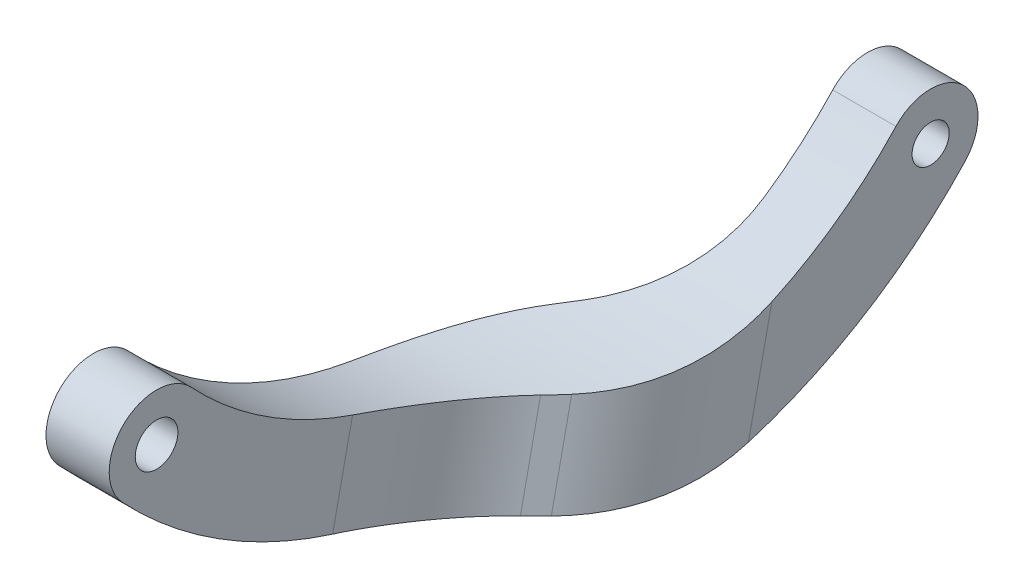
from build123d import *

# Parameters (mm, degrees)
SKETCH_1_R          = 1.175
SKETCH_1_R_2        = 1.35
EXTRUDE_1_DEPTH     = 4
SKETCH_1_5_R        = 1.175
EXTRUDE_2_DEPTH     = 12
SKETCH_1_6_R        = 1.175
CUT_EXTRUDE_1_DEPTH = 8
SKETCH_3_R          = 1.625
CUT_EXTRUDE_2_DEPTH = 1
CHAMFER_1_SIZE      = 10
FILLET_1_R          = 12


with BuildPart() as part:
    # 草图1 → 凸台-拉伸1 (new body)
    with BuildSketch(Plane(origin=(0, 0, 0), x_dir=(0, 0, -1), z_dir=(1, 0, 0))):
        with BuildLine():
            ThreePointArc((-22.696428571, -2.043453335), (0, -11.927768877), (22.696428571, -2.043453335))
            ThreePointArc((22.696428571, -2.043453335), (22.543453335, 2.196428571), (18.303571429, 2.043453335))
            ThreePointArc((18.303571429, 2.043453335), (0, -5.927768877), (-18.303571429, 2.043453335))
            ThreePointArc((-18.303571429, 2.043453335), (-22.543453335, 2.196428571), (-22.696428571, -2.043453335))
        make_face()
        with Locations((20.5, 0)):
            Circle(SKETCH_1_R, mode=Mode.SUBTRACT)
        with Locations((-20.5, 0)):
            Circle(SKETCH_1_R_2, mode=Mode.SUBTRACT)
    extrude(amount=EXTRUDE_1_DEPTH)

    # 草图1<5> → 凸台-拉伸2 (add)
    # profile 1 of 2: a face of its own
    with BuildSketch(Plane(origin=(0, 0, 0), x_dir=(0, 0, -1), z_dir=(1, 0, 0))):
        with BuildLine():
            Line((-5.226102274, -5.375424287), (-6.48036682, -11.242861585))
            ThreePointArc((-6.48036682, -11.242861585), (4.046311959, -11.66255958), (14.105677022, -8.532657498))
            Line((14.105677022, -8.532657498), (11.375545986, -3.189775829))
            ThreePointArc((11.375545986, -3.189775829), (3.263154806, -5.713890412), (-5.226102274, -5.375424287))
        make_face()
    # profile 2 of 2: a face of its own
    with BuildSketch(Plane(origin=(0, 0, 0), x_dir=(0, 0, -1), z_dir=(1, 0, 0))):
        with BuildLine():
            Line((11.375545986, -3.189775829), (14.105677022, -8.532657498))
            ThreePointArc((14.105677022, -8.532657498), (18.684918697, -5.663852102), (22.696428571, -2.043453335))
            ThreePointArc((22.696428571, -2.043453335), (22.543453335, 2.196428571), (18.303571429, 2.043453335))
            ThreePointArc((18.303571429, 2.043453335), (15.06848282, -0.876223091), (11.375545986, -3.189775829))
        make_face()
        with Locations((20.5, 0)):
            Circle(SKETCH_1_5_R, mode=Mode.SUBTRACT)
    extrude(amount=EXTRUDE_2_DEPTH)

    # 草图1<6> → 切除-拉伸1 (cut)
    with BuildSketch(Plane(origin=(0, 0, 0), x_dir=(0, 0, -1), z_dir=(1, 0, 0))):
        with BuildLine():
            Line((11.375545986, -3.189775829), (14.105677022, -8.532657498))
            ThreePointArc((14.105677022, -8.532657498), (18.684918697, -5.663852102), (22.696428571, -2.043453335))
            ThreePointArc((22.696428571, -2.043453335), (22.543453335, 2.196428571), (18.303571429, 2.043453335))
            ThreePointArc((18.303571429, 2.043453335), (15.06848282, -0.876223091), (11.375545986, -3.189775829))
        make_face()
        with Locations((20.5, 0)):
            Circle(SKETCH_1_6_R, mode=Mode.SUBTRACT)
    extrude(amount=CUT_EXTRUDE_1_DEPTH, mode=Mode.SUBTRACT)

    # 草图3 → 切除-拉伸2 (cut)
    with BuildSketch(Plane.ZY):
        with Locations((20.5, 0)):
            Circle(SKETCH_3_R)
    extrude(amount=-CUT_EXTRUDE_2_DEPTH, mode=Mode.SUBTRACT)

    # 倒角1
    # the kernel refuses this chamfer: 10 mm, written as the material it adds along each edge
    # the kernel refuses this chamfer: 10 mm, written as the material it takes off along each edge
    with BuildSketch(Plane(origin=(12, 19.773223518, -0.149849051), x_dir=(-0.9996219169112968, 0.005747850531589265, 0.02688838866222917), z_dir=(0, -0.9779062163770691, 0.20904409097385418))) as chamfer_1_2_piece_1_section:
        Polygon((CHAMFER_1_SIZE * 0.999621916911, CHAMFER_1_SIZE * 0.0274958766106), (-CHAMFER_1_SIZE * 0.0274958766106, CHAMFER_1_SIZE * 0.999621916911), (0, 0), align=None)
    chamfer_1_2_piece_1 = extrude(amount=57.433659759, mode=Mode.PRIVATE)
    chamfer_1_2_piece_1 = split(chamfer_1_2_piece_1, bisect_by=Plane(origin=(4, -8.720114363, 2.38807711), z_dir=(1, 0, 0)), keep=Keep.TOP, mode=Mode.PRIVATE)
    add(chamfer_1_2_piece_1, mode=Mode.SUBTRACT)
    with BuildSketch(Plane(origin=(0, 19.710553993, 0.32617325), x_dir=(-0.02749587661058638, -0.45484980336482234, 0.8901436025430942), z_dir=(0, -0.8904802780770589, -0.45502183942730046))) as chamfer_1_2_piece_2_section:
        Polygon((CHAMFER_1_SIZE * 0.999621916911, -CHAMFER_1_SIZE * 0.0274958766106), (-CHAMFER_1_SIZE * 0.0274958766106, -CHAMFER_1_SIZE * 0.999621916911), (0, 0), align=None)
    chamfer_1_2_piece_2 = extrude(amount=57.433659759, mode=Mode.PRIVATE)
    chamfer_1_2_piece_2 = split(chamfer_1_2_piece_2, bisect_by=Plane(origin=(8, -7.155033318, -9.499893675), z_dir=(-1, 0, 0)), keep=Keep.TOP, mode=Mode.PRIVATE)
    add(chamfer_1_2_piece_2, mode=Mode.SUBTRACT)

    # 圆角1
    fillet_1_edges = [part.edges().sort_by_distance(p)[0] for p in [
        (12, -8.568786932, -4.317191604),
        (8, -6.706828834, -10.92672743),
        (4, -8.656473826, 3.88229654),
        (0, -8.74431349, -2.983935031),
    ]]
    fillet(fillet_1_edges, radius=FILLET_1_R)


solid = part.part
